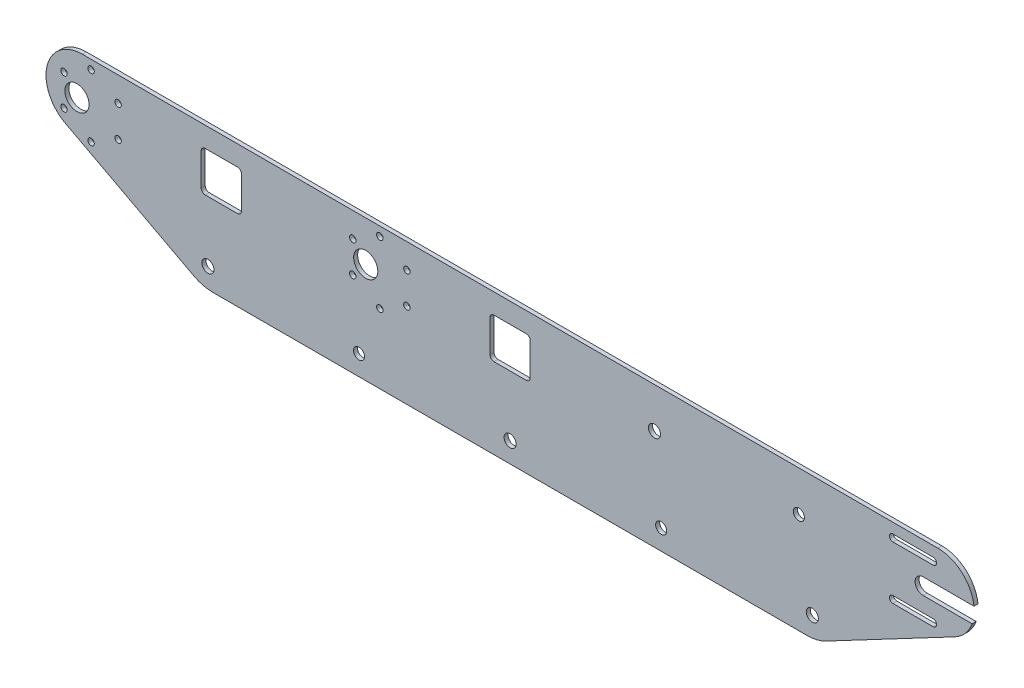
from build123d import *

# Parameters (mm, degrees)
ESQUISSE1_R             = 6
ESQUISSE1_R_2           = 3
BOSS_EXTRU_1_DEPTH      = 2
CONG_1_R                = 18
CONG_2_R                = 20
D_GAGEMENT_M32_D        = 3.4
ESQUISSE4_R             = 3
ENL_V_MAT_EXTRU_1_DEPTH = 234.819122898
ENL_V_MAT_EXTRU_2_DEPTH = 234.819122898
ESQUISSE8_R             = 1.6
ENL_V_MAT_EXTRU_3_DEPTH = 234.819122898
D_GAGEMENT_M51_D        = 5.5
D_GAGEMENT_M52_D        = 5.5
ESQUISSE13_W            = 20
ESQUISSE13_H            = 20
ENL_V_MAT_EXTRU_4_DEPTH = 234.819122898
CONG_3_R                = 2


with BuildPart() as part:
    # Esquisse1 → Boss.-Extru.1 (new body)
    with BuildSketch(Plane.XY):
        Polygon((-284.958991582, 40), (-247.300009613, 40), (248.333273954, 40), (284.958991582, 40), (248.333273954, 20.647569508), (152.479495791, -30), (-152.479495791, -30), (-247.300009613, 20.10160952), align=None)
        with Locations((-215, 20)):
            Circle(ESQUISSE1_R, mode=Mode.SUBTRACT)
        with Locations((-150, -20)):
            Circle(ESQUISSE1_R_2, mode=Mode.SUBTRACT)
        with Locations((150, -20)):
            Circle(ESQUISSE1_R_2, mode=Mode.SUBTRACT)
        with Locations((215, 20)):
            Circle(ESQUISSE1_R_2, mode=Mode.SUBTRACT)
        with Locations((0, -20)):
            Circle(ESQUISSE1_R_2, mode=Mode.SUBTRACT)
        with Locations((-71.666666667, 20)):
            Circle(ESQUISSE1_R, mode=Mode.SUBTRACT)
        with Locations((71.666666667, 20)):
            Circle(ESQUISSE1_R_2, mode=Mode.SUBTRACT)
    extrude(amount=BOSS_EXTRU_1_DEPTH)

    # Congé1
    cong_1_edges = [part.edges().sort_by_distance(p)[0] for p in [
        (-284.958991582, 40, 1),
        (284.958991582, 40, 1),
    ]]
    fillet(cong_1_edges, radius=CONG_1_R)

    # Congé2
    cong_2_edges = [part.edges().sort_by_distance(p)[0] for p in [
        (-152.479495791, -30, 1),
        (152.479495791, -30, 1),
    ]]
    fillet(cong_2_edges, radius=CONG_2_R)

    # Dégagement M32 (through all)
    with Locations(Plane(origin=(0, 0, 0), x_dir=(-1, 0, 0), z_dir=(0, 0, -1))):
        with Locations((-200, 33.228756555), (-200, 6.771243445)):
            Hole(D_GAGEMENT_M32_D / 2)

    # Esquisse4 → Enlèv. mat.-Extru.1 (cut, through all)
    with BuildSketch(Plane(origin=(0, 0, 0), x_dir=(-1, 0, 0), z_dir=(0, 0, -1))):
        with BuildLine():
            Line((-229.334149786, 16), (-205, 16))
            ThreePointArc((-205, 16), (-201, 20), (-205, 24))
            Line((-205, 24), (-230.252130857, 24))
            ThreePointArc((-230.252130857, 24), (-230.246241418, 19.948007721), (-229.334149786, 16))
        make_face()
        with Locations((-215, 20)):
            Circle(ESQUISSE4_R, mode=Mode.SUBTRACT)
    extrude(amount=-ENL_V_MAT_EXTRU_1_DEPTH, mode=Mode.SUBTRACT)

    # Esquisse7 → Enlèv. mat.-Extru.2 (cut, through all)
    with BuildSketch(Plane(origin=(0, 0, 0), x_dir=(-1, 0, 0), z_dir=(0, 0, -1))):
        with BuildLine():
            ThreePointArc((-200, 31.528756555), (-201.7, 33.228756555), (-200, 34.928756555))
            Line((-200, 34.928756555), (-210, 34.928756555))
            ThreePointArc((-210, 34.928756555), (-211.7, 33.228756555), (-210, 31.528756555))
            Line((-210, 31.528756555), (-200, 31.528756555))
        make_face()
        with BuildLine():
            Line((-190, 34.928756555), (-200, 34.928756555))
            ThreePointArc((-200, 34.928756555), (-198.3, 33.228756555), (-200, 31.528756555))
            Line((-200, 31.528756555), (-190, 31.528756555))
            ThreePointArc((-190, 31.528756555), (-188.3, 33.228756555), (-190, 34.928756555))
        make_face()
        with BuildLine():
            ThreePointArc((-200, 5.071243445), (-201.7, 6.771243445), (-200, 8.471243445))
            Line((-200, 8.471243445), (-210, 8.471243445))
            ThreePointArc((-210, 8.471243445), (-211.7, 6.771243445), (-210, 5.071243445))
            Line((-210, 5.071243445), (-200, 5.071243445))
        make_face()
        with BuildLine():
            Line((-190, 8.471243445), (-200, 8.471243445))
            ThreePointArc((-200, 8.471243445), (-198.3, 6.771243445), (-200, 5.071243445))
            Line((-200, 5.071243445), (-190, 5.071243445))
            ThreePointArc((-190, 5.071243445), (-188.3, 6.771243445), (-190, 8.471243445))
        make_face()
    extrude(amount=-ENL_V_MAT_EXTRU_2_DEPTH, mode=Mode.SUBTRACT)

    # Esquisse8 → Enlèv. mat.-Extru.3 (cut, through all)
    with BuildSketch(Plane(origin=(0, 0, 0), x_dir=(-1, 0, 0), z_dir=(0, 0, -1))):
        with Locations((208, 35.5)):
            Circle(ESQUISSE8_R)
        with Locations((194.576606241, 27.75)):
            Circle(ESQUISSE8_R)
        with Locations((194.576606241, 12.25)):
            Circle(ESQUISSE8_R)
        with Locations((208, 4.5)):
            Circle(ESQUISSE8_R)
        with Locations((221.423393759, 12.25)):
            Circle(ESQUISSE8_R)
        with Locations((221.423393759, 27.75)):
            Circle(ESQUISSE8_R)
        with Locations((64.666666667, 35.5)):
            Circle(ESQUISSE8_R)
        with Locations((51.243272908, 27.75)):
            Circle(ESQUISSE8_R)
        with Locations((51.243272908, 12.25)):
            Circle(ESQUISSE8_R)
        with Locations((64.666666667, 4.5)):
            Circle(ESQUISSE8_R)
        with Locations((78.090060425, 12.25)):
            Circle(ESQUISSE8_R)
        with Locations((78.090060425, 27.75)):
            Circle(ESQUISSE8_R)
    extrude(amount=-ENL_V_MAT_EXTRU_3_DEPTH, mode=Mode.SUBTRACT)

    # Dégagement M51 (through all)
    with Locations(Plane(origin=(0, 0, 0), x_dir=(-1, 0, 0), z_dir=(0, 0, -1))):
        with Locations((143.333333333, 20), (0, 20), (-143.333333333, 20)):
            Hole(D_GAGEMENT_M51_D / 2)

    # Dégagement M52 (through all)
    with Locations(Plane.XY.offset(2)):
        with Locations((-75, -20), (75, -20)):
            Hole(D_GAGEMENT_M52_D / 2)

    # Esquisse13 → Enlèv. mat.-Extru.4 (cut, through all)
    with BuildSketch(Plane.XY.offset(2)):
        with Locations((-143.333333333, 20)):
            Rectangle(ESQUISSE13_W, ESQUISSE13_H)
        with Locations((0, 20)):
            Rectangle(ESQUISSE13_W, ESQUISSE13_H)
    extrude(amount=-ENL_V_MAT_EXTRU_4_DEPTH, mode=Mode.SUBTRACT)

    # Congé3
    cong_3_edges = [part.edges().sort_by_distance(p)[0] for p in [
        (10, 30, 1),
        (-10, 30, 1),
        (-10, 10, 1),
        (10, 10, 1),
        (-133.333333333, 10, 1),
        (-153.333333333, 10, 1),
        (-133.333333333, 30, 1),
        (-153.333333333, 30, 1),
    ]]
    fillet(cong_3_edges, radius=CONG_3_R)


solid = part.part
